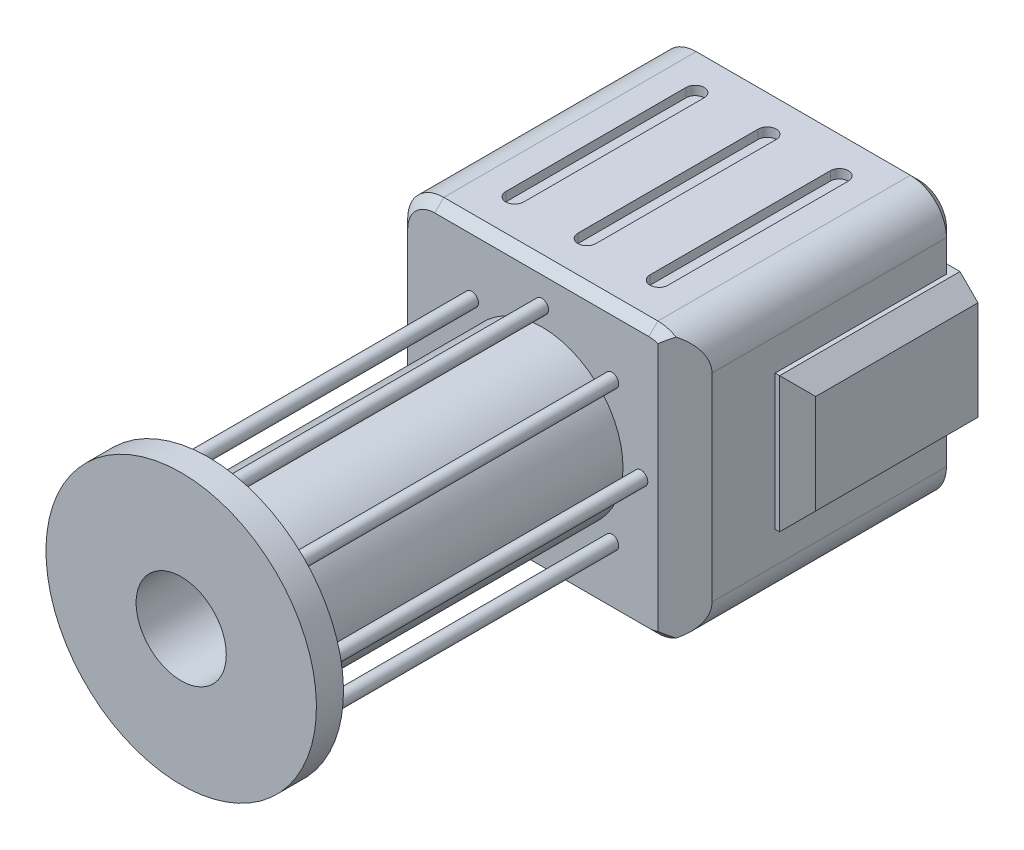
from build123d import *

# Parameters (mm, degrees)
SKETCH2_W           = 31.750972762
SKETCH2_H           = 30
BOSS_EXTRUDE1_DEPTH = 15
FILLET1_R           = 4
CHAMFER1_SIZE       = 3
CHAMFER2_SIZE       = 1
SKETCH4_R           = 10
BOSS_EXTRUDE2_DEPTH = 5
FILLET2_R           = 5
SKETCH5_W           = 5
SKETCH5_H           = 15
BOSS_EXTRUDE3_DEPTH = 20
CHAMFER3_SIZE       = 2
SKETCH6_R           = 5
CUT_EXTRUDE1_DEPTH  = 10
SKETCH7_R           = 0.75
BOSS_EXTRUDE4_DEPTH = 40
CIRPATTERN2_COUNT   = 8
SKETCH8_R           = 5
CUT_EXTRUDE2_DEPTH  = 10
CUT_EXTRUDE3_DEPTH  = 1
LPATTERN3_COUNT     = 2
LPATTERN3_PITCH     = 8
LPATTERN3_COL_COUNT = 2
LPATTERN3_COL_PITCH = 8


# Some blends are built 0.0001 mm under size
with BuildPart() as part:
    # Sketch2 → Boss-Extrude1 (new, symmetric)
    with BuildSketch(Plane.XY):
        Rectangle(SKETCH2_W, SKETCH2_H)
    extrude(amount=BOSS_EXTRUDE1_DEPTH, both=True)

    # Sketch3 → Revolve1 (revolve)
    with BuildSketch(Plane(origin=(0, 0, 0), x_dir=(0, 0, -1), z_dir=(1, 0, 0))):
        Polygon((-55, 0), (-55, 15), (-52, 15), (-52, 9), (-15, 9), (-15, 0), align=None)
    revolve(axis=Axis((0, 0, 15), (0, 0, 1)))

    # Fillet1
    fillet1_edges = [part.edges().sort_by_distance(p)[0] for p in [
        (15.875486381, -15, 0),
        (-15.875486381, -15, 0),
        (-15.875486381, 15, 0),
        (15.875486381, 15, 0),
    ]]
    fillet(fillet1_edges, radius=FILLET1_R)

    # Chamfer1
    # the kernel refuses this chamfer: 3 mm, written as the material it takes off along each edge
    with BuildSketch(Plane(origin=(15.875486381, 18.715048964, 15), x_dir=(-0.9996219169112969, 0, 0.02749587661058621), z_dir=(0, -1, 0))) as chamfer1_piece_1:
        Polygon((CHAMFER1_SIZE * 0.999621916911, CHAMFER1_SIZE * 0.0274958766106), (-CHAMFER1_SIZE * 0.0274958766106, CHAMFER1_SIZE * 0.999621916911), (0, 0), align=None)
    extrude(amount=37.430097928, mode=Mode.SUBTRACT)

    # Chamfer2
    chamfer2_edges = [part.edges().sort_by_distance(p)[0] for p in [
        (0, -15, -15),
        (14.703913506, -13.828427125, -15),
        (-14.703913506, -13.828427125, -15),
        (15.875486381, 0, -15),
        (-15.875486381, 0, -15),
        (14.703913506, 13.828427125, -15),
        (-14.703913506, 13.828427125, -15),
        (0, 15, -15),
        (12.379503551, -14.968118785, 15),
        (0, -15, 15),
        (-14.703913506, -13.828427125, 15),
        (-15.875486381, 0, 15),
        (12.379503551, 14.968118785, 15),
        (-14.703913506, 13.828427125, 15),
        (0, 15, 15),
    ]]
    chamfer(chamfer2_edges, length=CHAMFER2_SIZE)

    # Sketch4 → Boss-Extrude2 (add)
    with BuildSketch(Plane(origin=(0, 0, -15), x_dir=(-1, 0, 0), z_dir=(0, 0, -1))):
        Circle(SKETCH4_R)
    extrude(amount=BOSS_EXTRUDE2_DEPTH)

    # Fillet2
    fillet2_edges = [part.edges().sort_by_distance(p)[0] for p in [
        (10, 0, -20),
    ]]
    fillet(fillet2_edges, radius=FILLET2_R - 0.0001)  # a hair under: the kernel refuses the full size

    # Sketch5 → Boss-Extrude3 (add)
    with BuildSketch(Plane(origin=(0, 0, -15), x_dir=(-1, 0, 0), z_dir=(0, 0, -1))):
        with Locations((-15.875486381, 0)):
            Rectangle(SKETCH5_W, SKETCH5_H)
    extrude(amount=-BOSS_EXTRUDE3_DEPTH)

    # Chamfer3
    chamfer3_edges = [part.edges().sort_by_distance(p)[0] for p in [
        (18.375486381, 7.5, -5),
        (18.375486381, 0, 5),
        (18.375486381, -7.5, -5),
    ]]
    chamfer(chamfer3_edges, length=CHAMFER3_SIZE)

    # Sketch6 → Cut-Extrude1 (cut)
    with BuildSketch(Plane.XY.offset(55)):
        Circle(SKETCH6_R)
    extrude(amount=-CUT_EXTRUDE1_DEPTH, mode=Mode.SUBTRACT)

    # Sketch7 → Boss-Extrude4 (add)
    with BuildSketch(Plane.XY.offset(55)):
        with Locations((0, 11)):
            Circle(SKETCH7_R)
    boss_extrude4 = extrude(amount=-BOSS_EXTRUDE4_DEPTH)

    # CirPattern2: Boss-Extrude4 ×8 about axis
    cirpattern2_axis = Axis((0, 0, 0), (0, 0, 1))
    for i in range(1, CIRPATTERN2_COUNT):
        add(boss_extrude4.rotate(cirpattern2_axis, i * 360 / CIRPATTERN2_COUNT))

    # Sketch8 → Cut-Extrude2 (cut)
    with BuildSketch(Plane.ZY.offset(15.875486381)):
        Circle(SKETCH8_R)
    extrude(amount=-CUT_EXTRUDE2_DEPTH, mode=Mode.SUBTRACT)

    # Sketch9 → Cut-Extrude3 (cut)
    with BuildSketch(Plane(origin=(0, 15, 0), x_dir=(1, 0, 0), z_dir=(0, 1, 0))):
        with BuildLine():
            Line((1, 10), (1, -10))
            ThreePointArc((1, -10), (0, -11), (-1, -10))
            Line((-1, -10), (-1, 10))
            ThreePointArc((-1, 10), (0, 11), (1, 10))
        make_face()
    cut_extrude3 = extrude(amount=-CUT_EXTRUDE3_DEPTH, mode=Mode.SUBTRACT)

    # LPattern3: Cut-Extrude3 ×2
    with Locations(*[(-i * LPATTERN3_PITCH, 0, 0) for i in range(1, LPATTERN3_COUNT)]):
        add(cut_extrude3, mode=Mode.SUBTRACT)

    # LPattern3 col: Cut-Extrude3 ×2
    with Locations(*[(i * LPATTERN3_COL_PITCH, 0, 0) for i in range(1, LPATTERN3_COL_COUNT)]):
        add(cut_extrude3, mode=Mode.SUBTRACT)


solid = part.part
